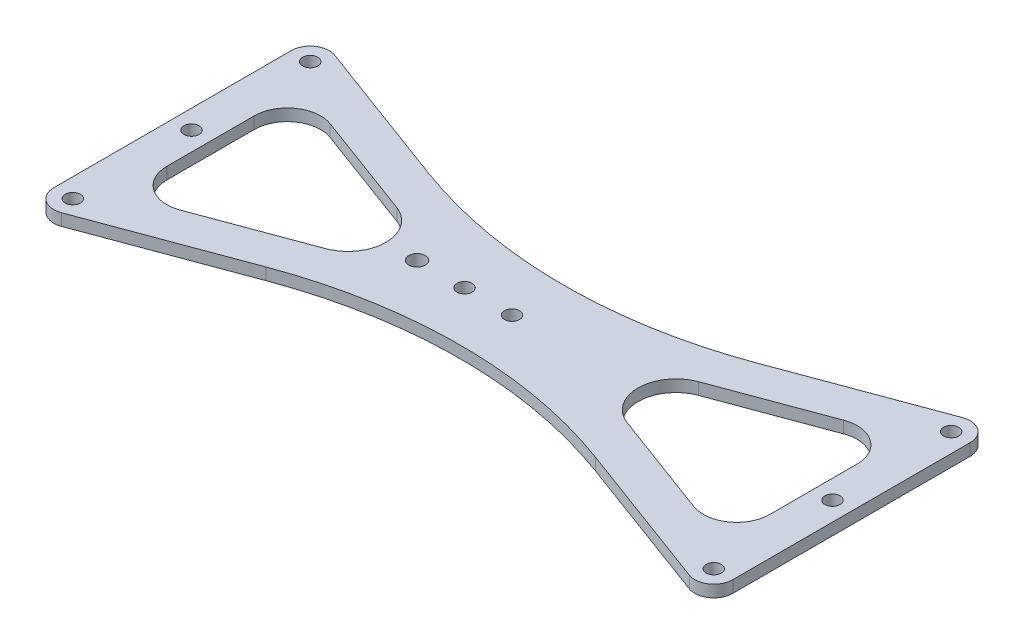
from build123d import *

# Parameters (mm, degrees)
SKETCH1_R           = 2.032
BOSS_EXTRUDE1_DEPTH = 3.175
FILLET1_R           = 8.89
FILLET2_R           = 10.16
FILLET3_R           = 127
SKETCH1_3_R         = 2.032
SKETCH1_3_R_2       = 2.2225
CUT_EXTRUDE1_DEPTH  = 99.041203328


with BuildPart() as part:
    # Sketch1 → Boss-Extrude1 (new body)
    with BuildSketch(Plane(origin=(0, 0, 0), x_dir=(1, 0, 0), z_dir=(0, 1, 0))):
        with BuildLine():
            Line((90.805, -31.75), (90.805, 31.75))
            ThreePointArc((90.805, 31.75), (88.627022296, 35.919492367), (83.960643072, 36.513763704))
            Line((83.960643072, 36.513763704), (0, 5.417229233))
            Line((0, 5.417229233), (-83.960643072, 36.513763704))
            ThreePointArc((-83.960643072, 36.513763704), (-88.627022296, 35.919492367), (-90.805, 31.75))
            Line((-90.805, 31.75), (-90.805, -31.75))
            ThreePointArc((-90.805, -31.75), (-88.627022296, -35.919492367), (-83.960643072, -36.513763704))
            Line((-83.960643072, -36.513763704), (0, -5.417229233))
            Line((0, -5.417229233), (83.960643072, -36.513763704))
            ThreePointArc((83.960643072, -36.513763704), (88.627022296, -35.919492367), (90.805, -31.75))
        make_face()
        Polygon((80.645, 24.451289285), (80.645, -24.451289285), (14.62651893, 0), align=None, mode=Mode.SUBTRACT)
        with Locations((85.725, 0)):
            Circle(SKETCH1_R, mode=Mode.SUBTRACT)
        with Locations((85.725, 31.75)):
            Circle(SKETCH1_R, mode=Mode.SUBTRACT)
        with Locations((85.725, -31.75)):
            Circle(SKETCH1_R, mode=Mode.SUBTRACT)
        Polygon((-80.645, -24.451289285), (-80.645, 24.451289285), (-14.62651893, 0), align=None, mode=Mode.SUBTRACT)
        with Locations((-85.725, -31.75)):
            Circle(SKETCH1_R, mode=Mode.SUBTRACT)
        with Locations((-85.725, 31.75)):
            Circle(SKETCH1_R, mode=Mode.SUBTRACT)
        with Locations((-85.725, 0)):
            Circle(SKETCH1_R, mode=Mode.SUBTRACT)
    extrude(amount=BOSS_EXTRUDE1_DEPTH)

    # Fillet1
    fillet1_edges = [part.edges().sort_by_distance(p)[0] for p in [
        (-80.645, 1.5875, 24.451289285),
        (-80.645, 1.5875, -24.451289285),
        (80.645, 1.5875, 24.451289285),
        (80.645, 1.5875, -24.451289285),
    ]]
    fillet(fillet1_edges, radius=FILLET1_R)

    # Fillet2
    fillet2_edges = [part.edges().sort_by_distance(p)[0] for p in [
        (14.62651893, 1.5875, 0),
        (-14.62651893, 1.5875, 0),
    ]]
    fillet(fillet2_edges, radius=FILLET2_R)

    # Fillet3
    fillet3_edges = [part.edges().sort_by_distance(p)[0] for p in [
        (0, 1.5875, 5.417229233),
        (0, 1.5875, -5.417229233),
    ]]
    fillet(fillet3_edges, radius=FILLET3_R)

    # Sketch1<3> → Cut-Extrude1 (cut, through all)
    with BuildSketch(Plane(origin=(0, 0, 0), x_dir=(1, 0, 0), z_dir=(0, 1, 0))):
        Circle(SKETCH1_3_R)
        with Locations((-12.7, 0)):
            Circle(SKETCH1_3_R)
        with Locations((-25.4, 0)):
            Circle(SKETCH1_3_R_2)
    extrude(amount=CUT_EXTRUDE1_DEPTH, mode=Mode.SUBTRACT)


solid = part.part
